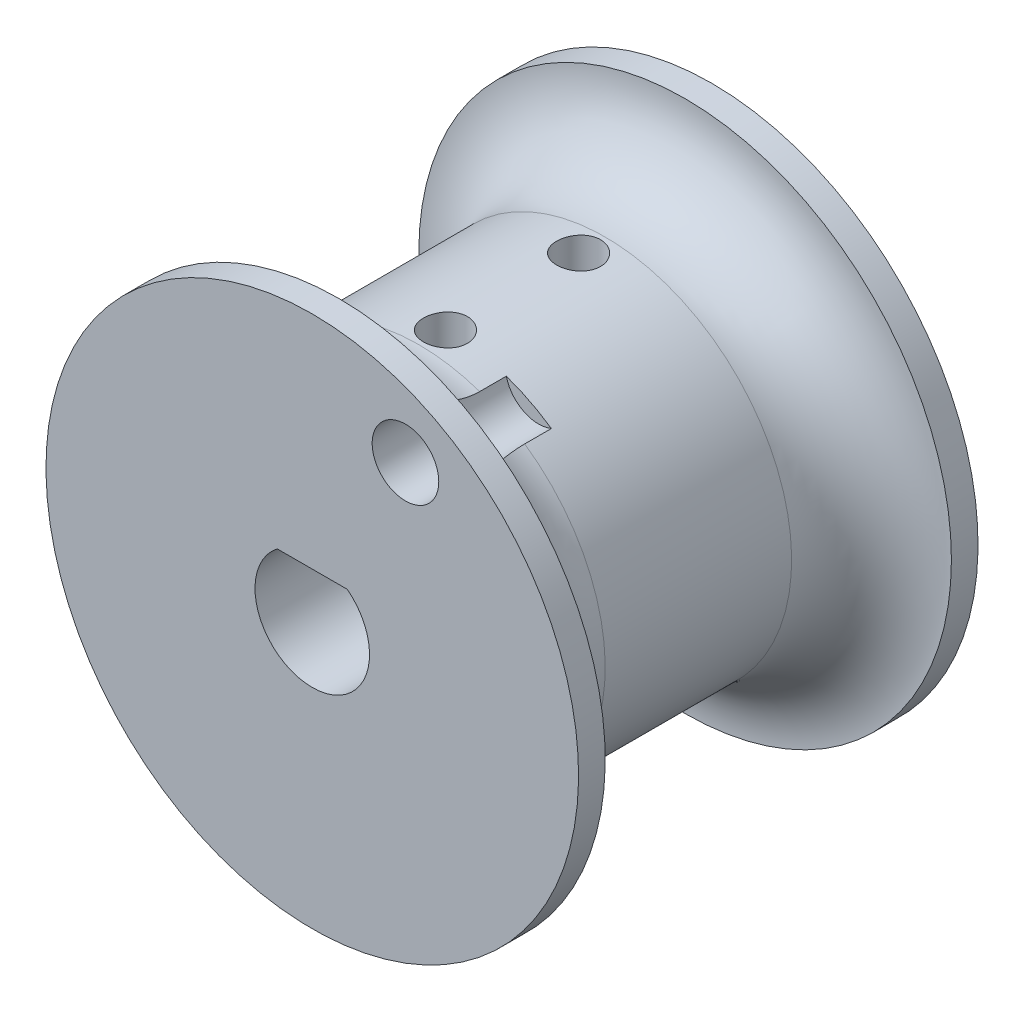
from build123d import *

# Parameters (mm, degrees)
CUT_EXTRUDE1_DEPTH                   = 42.231056256
SKETCH5_W                            = 1.65
SKETCH5_H                            = 20
TAP_DRILL_FOR_M4X0_7_TAP1_AT_2_COUNT = 2
TAP_DRILL_FOR_M4X0_7_TAP1_AT_2_PITCH = 10
FILLET_2_R                           = 6
SKETCH6_R                            = 2.5
CUT_EXTRUDE2_DEPTH                   = 10


with BuildPart() as part:
    # Sketch1 → Revolve1 (revolve)
    with BuildSketch(Plane(origin=(0, 0, 0), x_dir=(0, 0, -1), z_dir=(1, 0, 0))):
        Polygon((0, 0), (0, 14), (13, 14), (13, 20), (15, 20), (15, 0), align=None)
    revolve1 = revolve(axis=Axis((0, 0, -15), (0, 0, 1)))

    # Mirror1: Revolve1 across plane
    add(revolve1.mirror(Plane.XY))

    # Sketch2 → Cut-Extrude1 (cut, through all)
    with BuildSketch(Plane.XY.offset(15)):
        with BuildLine():
            Line((-2.632489316, 3.4), (2.632489316, 3.4))
            ThreePointArc((2.632489316, 3.4), (0, -4.3), (-2.632489316, 3.4))
        make_face()
    extrude(amount=-CUT_EXTRUDE1_DEPTH, mode=Mode.SUBTRACT)

    # Sketch5 → Tap Drill for M4x0.7 Tap1 (revolve, cut)
    with BuildSketch(Plane(origin=(0, 0, -5), x_dir=(0, 0, -1), z_dir=(1, 0, 0))):
        with Locations((0.825, 10)):
            Rectangle(SKETCH5_W, SKETCH5_H)
    tap_drill_for_m4x0_7_tap1 = revolve(axis=Axis((0, -6.35, -5), (0, 1, 0)), mode=Mode.SUBTRACT)

    # Tap Drill for M4x0.7 Tap1 at 2: Tap Drill for M4x0.7 Tap1 ×2
    with Locations(*[(0, 0, i * TAP_DRILL_FOR_M4X0_7_TAP1_AT_2_PITCH) for i in range(1, TAP_DRILL_FOR_M4X0_7_TAP1_AT_2_COUNT)]):
        add(tap_drill_for_m4x0_7_tap1, mode=Mode.SUBTRACT)

    # Fillet 2
    fillet_2_edges = [part.edges().sort_by_distance(p)[0] for p in [
        (0, -14, 13),
        (0, -14, -13),
    ]]
    fillet(fillet_2_edges, radius=FILLET_2_R - 0.0001)  # a hair under: the kernel refuses the full size

    # Sketch6 → Cut-Extrude2 (cut)
    with BuildSketch(Plane.XY.offset(15)):
        with Locations((7, 13.829316686)):
            Circle(SKETCH6_R)
    extrude(amount=-CUT_EXTRUDE2_DEPTH, mode=Mode.SUBTRACT)


solid = part.part
